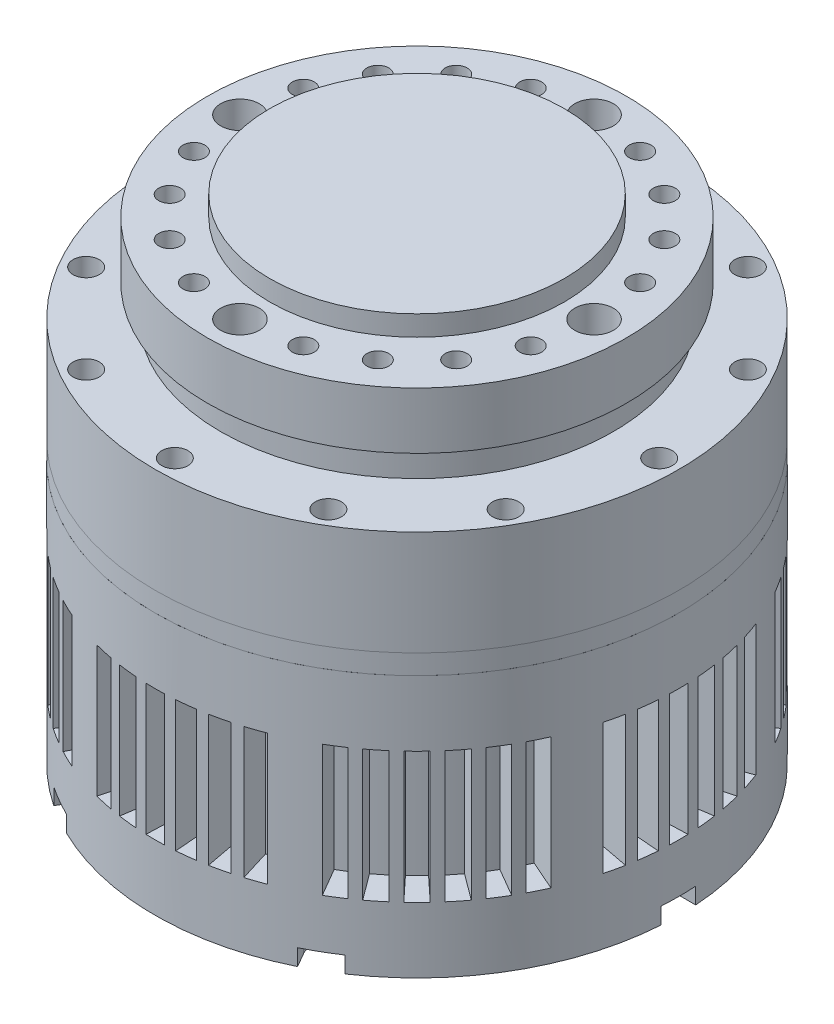
from build123d import *

# Parameters (mm, degrees)
SKETCH1_R           = 40
BOSS_EXTRUDE1_DEPTH = 16
SKETCH2_R           = 2
CUT_EXTRUDE1_DEPTH  = 5
CIRPATTERN1_COUNT   = 12
SKETCH3_R           = 40
BOSS_EXTRUDE2_DEPTH = 3
SKETCH4_R           = 40
BOSS_EXTRUDE3_DEPTH = 40
SKETCH6_R           = 30
BOSS_EXTRUDE4_DEPTH = 4.75
SKETCH8_R           = 32
BOSS_EXTRUDE5_DEPTH = 8.65
SKETCH9_R           = 22.5
BOSS_EXTRUDE6_DEPTH = 3.1
SKETCH10_R          = 2.95
CUT_EXTRUDE5_DEPTH  = 7
CIRPATTERN3_COUNT   = 4
SKETCH14_R          = 1.675
CUT_EXTRUDE6_DEPTH  = 7
CIRPATTERN4_COUNT   = 20
CUT_EXTRUDE8_DEPTH  = 2.5
CIRPATTERN5_COUNT   = 6
CUT_EXTRUDE9_START  = -10
CUT_EXTRUDE9_DEPTH  = 20
CIRPATTERN6_COUNT   = 8


with BuildPart() as part:
    # Sketch1 → Boss-Extrude1 (new body)
    with BuildSketch(Plane(origin=(0, 0, 0), x_dir=(1, 0, 0), z_dir=(0, 1, 0))):
        Circle(SKETCH1_R)
    extrude(amount=BOSS_EXTRUDE1_DEPTH)

    # Sketch2 → Cut-Extrude1 (cut)
    with BuildSketch(Plane(origin=(0, 16, 0), x_dir=(1, 0, 0), z_dir=(0, 1, 0))):
        with Locations((0, 37)):
            Circle(SKETCH2_R)
    cut_extrude1 = extrude(amount=-CUT_EXTRUDE1_DEPTH, mode=Mode.SUBTRACT)

    # CirPattern1: Cut-Extrude1 ×12 about axis
    cirpattern1_axis = Axis((0, 16, 0), (0, 1, 0))
    for i in range(1, CIRPATTERN1_COUNT):
        add(cut_extrude1.rotate(cirpattern1_axis, i * 360 / CIRPATTERN1_COUNT), mode=Mode.SUBTRACT)


with BuildPart() as body_2:
    # Sketch3 → Boss-Extrude2 (new body)
    with BuildSketch(Plane.XZ):
        Circle(SKETCH3_R)
    extrude(amount=BOSS_EXTRUDE2_DEPTH)


with BuildPart() as body_3:
    # Sketch4 → Boss-Extrude3 (new body)
    with BuildSketch(Plane.XZ.offset(3)):
        Circle(SKETCH4_R)
    extrude(amount=BOSS_EXTRUDE3_DEPTH)

    # Sketch16 → Cut-Extrude8 (cut)
    with BuildSketch(Plane.XZ.offset(43)):
        with BuildLine():
            Line((20.976067743, 30.998281741), (22.26490714, 33.230617058))
            ThreePointArc((22.26490714, 33.230617058), (20, 34.641016151), (17.646104986, 35.897283725))
            Line((17.646104986, 35.897283725), (16.35726559, 33.664948408))
            ThreePointArc((16.35726559, 33.664948408), (17.333333333, 30.022213998), (20.976067743, 30.998281741))
        make_face()
    cut_extrude8 = extrude(amount=-CUT_EXTRUDE8_DEPTH, mode=Mode.SUBTRACT)

    # CirPattern5: Cut-Extrude8 ×6 about axis
    cirpattern5_axis = Axis((0, -43, 0), (0, -1, 0))
    for i in range(1, CIRPATTERN5_COUNT):
        add(cut_extrude8.rotate(cirpattern5_axis, i * 360 / CIRPATTERN5_COUNT), mode=Mode.SUBTRACT)

    # Sketch5 → Cut-Extrude9 (cut)
    with BuildSketch(Plane.XZ.offset(43).offset(CUT_EXTRUDE9_START)):
        with BuildLine():
            Line((-10.229664414, 38.669806904), (-8.950956362, 33.836081041))
            ThreePointArc((-8.950956362, 33.836081041), (-7.736814557, 34.134172035), (-6.512801217, 34.388710652))
            Line((-6.512801217, 34.388710652), (-7.443201391, 39.301383602))
            ThreePointArc((-7.443201391, 39.301383602), (-8.842073779, 39.010482326), (-10.229664414, 38.669806904))
        make_face()
        with BuildLine():
            Line((-5.132317687, 34.621659625), (-5.865505928, 39.567610999))
            ThreePointArc((-5.865505928, 39.567610999), (-4.448635014, 39.751850856), (-3.02608801, 39.885370643))
            Line((-3.02608801, 39.885370643), (-2.647827009, 34.899699313))
            ThreePointArc((-2.647827009, 34.899699313), (-3.892555637, 34.782869499), (-5.132317687, 34.621659625))
        make_face()
        with BuildLine():
            Line((-1.428571429, 39.974481656), (-1.25, 34.977671449))
            ThreePointArc((-1.25, 34.977671449), (0, 35), (1.25, 34.977671449))
            Line((1.25, 34.977671449), (1.428571429, 39.974481656))
            ThreePointArc((1.428571429, 39.974481656), (0, 40), (-1.428571429, 39.974481656))
        make_face()
        with BuildLine():
            Line((2.647827009, 34.899699313), (3.02608801, 39.885370643))
            ThreePointArc((3.02608801, 39.885370643), (4.448635014, 39.751850856), (5.865505928, 39.567610999))
            Line((5.865505928, 39.567610999), (5.132317687, 34.621659625))
            ThreePointArc((5.132317687, 34.621659625), (3.892555637, 34.782869499), (2.647827009, 34.899699313))
        make_face()
        with BuildLine():
            Line((7.443201391, 39.301383602), (6.512801217, 34.388710652))
            ThreePointArc((6.512801217, 34.388710652), (7.736814557, 34.134172035), (8.950956362, 33.836081041))
            Line((8.950956362, 33.836081041), (10.229664414, 38.669806904))
            ThreePointArc((10.229664414, 38.669806904), (8.842073779, 39.010482326), (7.443201391, 39.301383602))
        make_face()
        with BuildLine():
            Line((14.466898777, 37.292208835), (12.65853643, 32.63068273))
            ThreePointArc((12.65853643, 32.63068273), (11.485079282, 33.061956293), (10.296968123, 33.451045536))
            Line((10.296968123, 33.451045536), (11.767963569, 38.229766327))
            ThreePointArc((11.767963569, 38.229766327), (13.125804893, 37.785092906), (14.466898777, 37.292208835))
        make_face()
    cut_extrude9 = extrude(amount=-CUT_EXTRUDE9_DEPTH, mode=Mode.SUBTRACT)

    # CirPattern6: Cut-Extrude9 ×8 about axis
    cirpattern6_axis = Axis((0, 16, 0), (0, 1, 0))
    for i in range(1, CIRPATTERN6_COUNT):
        add(cut_extrude9.rotate(cirpattern6_axis, i * 360 / CIRPATTERN6_COUNT), mode=Mode.SUBTRACT)


with BuildPart() as body_4:
    # Sketch6 → Boss-Extrude4 (new body)
    with BuildSketch(Plane(origin=(0, 16, 0), x_dir=(1, 0, 0), z_dir=(0, 1, 0))):
        Circle(SKETCH6_R)
    extrude(amount=BOSS_EXTRUDE4_DEPTH)


with BuildPart() as body_5:
    # Sketch8 → Boss-Extrude5 (new body)
    with BuildSketch(Plane(origin=(0, 20.75, 0), x_dir=(1, 0, 0), z_dir=(0, 1, 0))):
        Circle(SKETCH8_R)
    extrude(amount=BOSS_EXTRUDE5_DEPTH)

    # Sketch9 → Boss-Extrude6 (add)
    with BuildSketch(Plane(origin=(0, 29.4, 0), x_dir=(1, 0, 0), z_dir=(0, 1, 0))):
        Circle(SKETCH9_R)
    extrude(amount=BOSS_EXTRUDE6_DEPTH)

    # Sketch10 → Cut-Extrude5 (cut)
    with BuildSketch(Plane(origin=(0, 29.4, 0), x_dir=(1, 0, 0), z_dir=(0, 1, 0))):
        with Locations((0, 27.05)):
            Circle(SKETCH10_R)
    cut_extrude5 = extrude(amount=-CUT_EXTRUDE5_DEPTH, mode=Mode.SUBTRACT)

    # CirPattern3: Cut-Extrude5 ×4 about axis
    cirpattern3_axis = Axis((0, 32.5, 0), (0, 1, 0))
    for i in range(1, CIRPATTERN3_COUNT):
        add(cut_extrude5.rotate(cirpattern3_axis, i * 360 / CIRPATTERN3_COUNT), mode=Mode.SUBTRACT)

    # Sketch14 → Cut-Extrude6 (cut)
    with BuildSketch(Plane(origin=(0, 29.4, 0), x_dir=(1, 0, 0), z_dir=(0, 1, 0))):
        with Locations((25.726078766, 8.358909698)):
            Circle(SKETCH14_R)
    cut_extrude6 = extrude(amount=-CUT_EXTRUDE6_DEPTH, mode=Mode.SUBTRACT)

    # CirPattern4: Cut-Extrude6 ×20 about axis, 4 skipped
    cirpattern4_axis = Axis((0, 32.5, 0), (0, 1, 0))
    add([cut_extrude6.rotate(cirpattern4_axis, i * 360 / CIRPATTERN4_COUNT) for i in range(1, CIRPATTERN4_COUNT) if i not in (4, 9, 14, 19)], mode=Mode.SUBTRACT)


solid = Compound([part.part, body_2.part, body_3.part, body_4.part, body_5.part])
